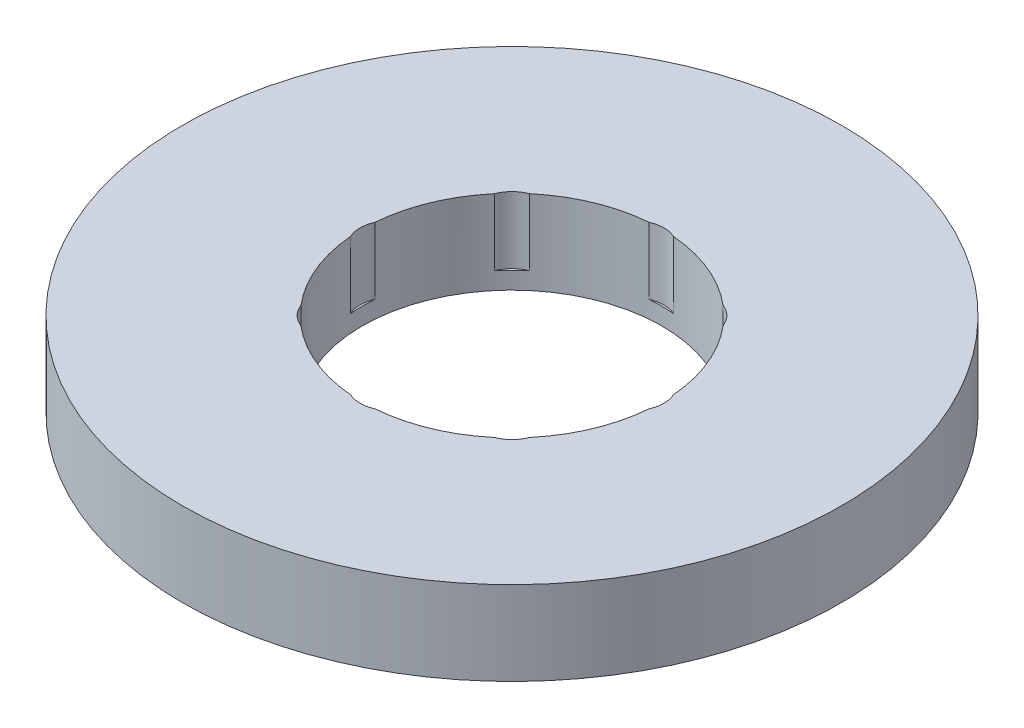
from build123d import *

# Parameters (mm, degrees)
SKETCH1_R           = 82.5
BOSS_EXTRUDE1_DEPTH = 21
SKETCH2_R           = 37.5
CUT_EXTRUDE1_DEPTH  = 119.547458851
SKETCH3_R           = 7.498579311
CUT_EXTRUDE2_DEPTH  = 16.707928145
CIRPATTERN1_COUNT   = 8


with BuildPart() as part:
    # Sketch1 → Boss-Extrude1 (new body)
    with BuildSketch(Plane(origin=(0, 0, 0), x_dir=(1, 0, 0), z_dir=(0, 1, 0))):
        Circle(SKETCH1_R)
    extrude(amount=BOSS_EXTRUDE1_DEPTH)

    # Sketch2 → Cut-Extrude1 (cut, through all)
    with BuildSketch(Plane(origin=(0, 0, 0), x_dir=(1, 0, 0), z_dir=(0, 1, 0))):
        Circle(SKETCH2_R)
    extrude(amount=CUT_EXTRUDE1_DEPTH, mode=Mode.SUBTRACT)

    # Sketch3 → Cut-Extrude2 (cut)
    with BuildSketch(Plane(origin=(0, 21, 0), x_dir=(1, 0, 0), z_dir=(0, 1, 0))):
        with Locations((-30.532374702, 0)):
            Circle(SKETCH3_R)
    cut_extrude2 = extrude(amount=-CUT_EXTRUDE2_DEPTH, mode=Mode.SUBTRACT)

    # CirPattern1: Cut-Extrude2 ×8 about axis
    cirpattern1_axis = Axis((0, 0, 0), (0, 1, 0))
    for i in range(1, CIRPATTERN1_COUNT):
        add(cut_extrude2.rotate(cirpattern1_axis, i * 360 / CIRPATTERN1_COUNT), mode=Mode.SUBTRACT)


solid = part.part
